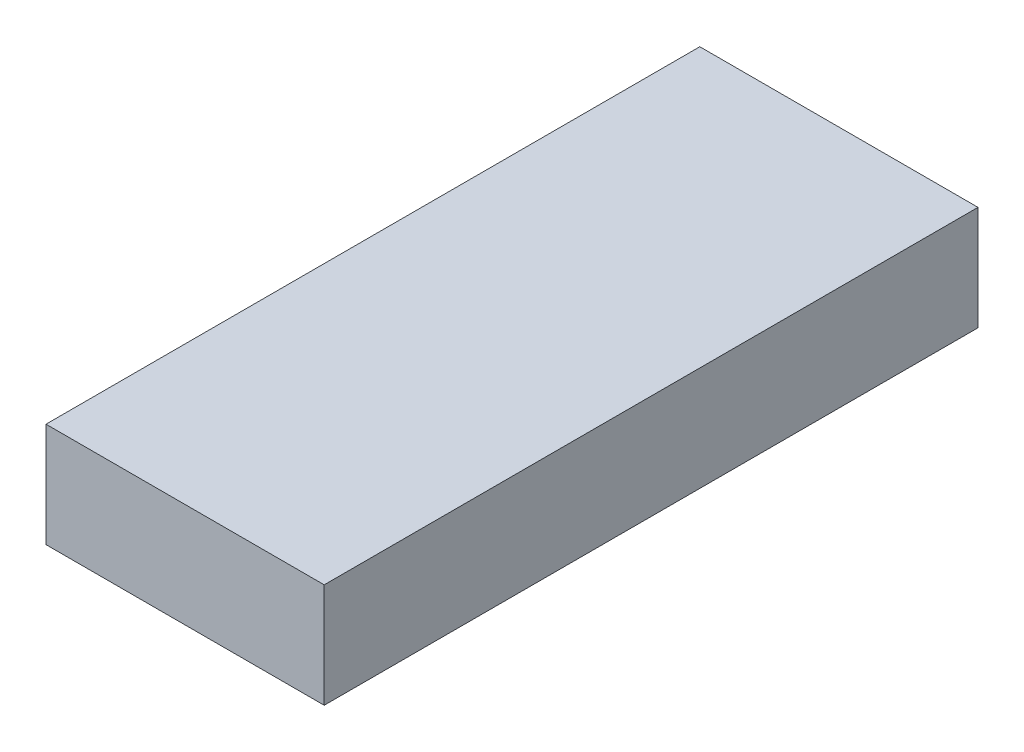
from build123d import *

# Parameters (mm, degrees)
SKETCH2_W           = 25.4
SKETCH2_H           = 59.69
BOSS_EXTRUDE1_DEPTH = 9.525


with BuildPart() as part:
    # Sketch2 → Boss-Extrude1 (new body)
    with BuildSketch(Plane(origin=(0, 0, 0), x_dir=(1, 0, 0), z_dir=(0, 1, 0))):
        Rectangle(SKETCH2_W, SKETCH2_H)
    extrude(amount=BOSS_EXTRUDE1_DEPTH)


solid = part.part
